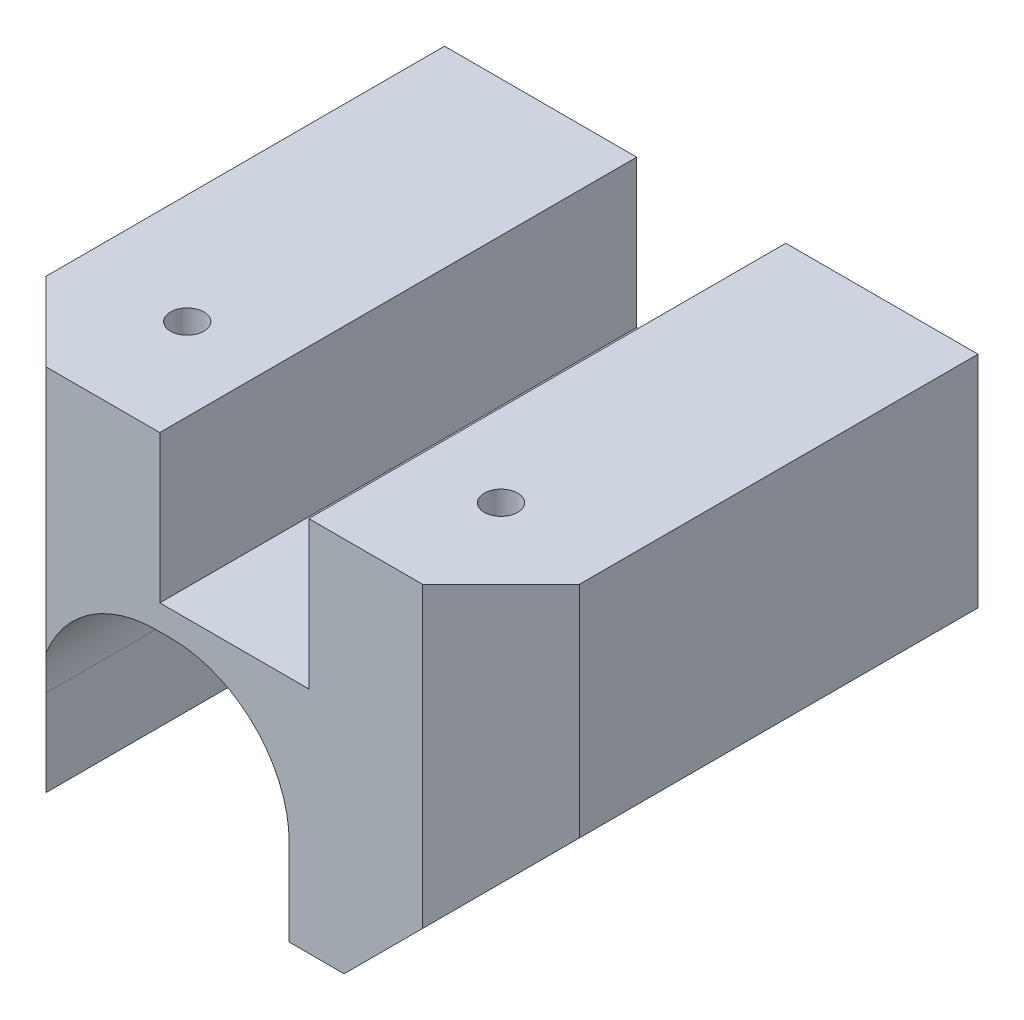
from build123d import *

# Parameters (mm, degrees)
SKETCH1_W                 = 43.18
SKETCH1_H                 = 38.608
BOSS_EXTRUDE1_DEPTH       = 30.48
SIDECHAMFER_SIZE          = 12.7
BACKCHAMFERS_SIZE         = 6.35
SKETCH2_W                 = 12.065
SKETCH2_H                 = 11.938
LINACTSLOT_DEPTH          = 54.719048428
MOUTINGHOLES_D            = 2.7051
MOUTINGHOLES_DEPTH        = 14.478
MOUTINGHOLES_TIP          = 0.81269403
CUT_EXTRUDE1_DEPTH        = 54.719048428
MOTORMOUNTINGHOLES2_D     = 2.2606
MOTORMOUNTINGHOLES2_DEPTH = 11.43
MOTORMOUNTINGHOLES2_TIP   = 0.679152758


with BuildPart() as part:
    # Sketch1 → Boss-Extrude1 (new body)
    with BuildSketch(Plane(origin=(0, 0, 0), x_dir=(1, 0, 0), z_dir=(0, 1, 0))):
        Rectangle(SKETCH1_W, SKETCH1_H)
    extrude(amount=BOSS_EXTRUDE1_DEPTH)

    # SideChamfer
    sidechamfer_edges = [part.edges().sort_by_distance(p)[0] for p in [
        (21.59, 0, 0),
    ]]
    chamfer(sidechamfer_edges, length=SIDECHAMFER_SIZE)

    # BackChamfers
    backchamfers_edges = [part.edges().sort_by_distance(p)[0] for p in [
        (-21.59, 15.24, 19.304),
        (21.59, 21.59, 19.304),
    ]]
    chamfer(backchamfers_edges, length=BACKCHAMFERS_SIZE)

    # Sketch2 → LinActSlot (cut, through all)
    with BuildSketch(Plane.XY.offset(19.304)):
        with Locations((0, 24.511)):
            Rectangle(SKETCH2_W, SKETCH2_H)
    extrude(amount=-LINACTSLOT_DEPTH, mode=Mode.SUBTRACT)

    # MoutingHoles
    with Locations(Plane(origin=(14.160350453, 30.48, 8.373414988), x_dir=(-1, 0, 0), z_dir=(0, 1, 0))):
        with Locations((1.460350453, 2.040585012), (26.860350453, 2.040585012)):
            Hole(MOUTINGHOLES_D / 2, depth=MOUTINGHOLES_DEPTH)
            with Locations((0, 0, -(MOUTINGHOLES_DEPTH + MOUTINGHOLES_TIP / 2))):  # 118° drill point
                Cone(0, MOUTINGHOLES_D / 2, MOUTINGHOLES_TIP, mode=Mode.SUBTRACT)

    # Sketch11 → Cut-Extrude1 (cut, through all)
    with BuildSketch(Plane(origin=(0, 0, -19.304), x_dir=(-1, 0, 0), z_dir=(0, 0, -1))):
        with BuildLine():
            Line((15.875, 6.35), (15.875, 6.985))
            ThreePointArc((15.875, 6.985), (13.085192091, 13.720192091), (6.35, 16.51))
            Line((6.35, 16.51), (5.08, 16.51))
            ThreePointArc((5.08, 16.51), (-1.655192091, 13.720192091), (-4.445, 6.985))
            Line((-4.445, 6.985), (-4.445, 6.35))
            Line((-4.445, 6.35), (-4.445, 0))
            Line((-4.445, 0), (15.875, 0))
            Line((15.875, 0), (15.875, 6.35))
        make_face()
    extrude(amount=-CUT_EXTRUDE1_DEPTH, mode=Mode.SUBTRACT)

    # MotorMountingHoles2
    with Locations(Plane(origin=(0, 0, -19.304), x_dir=(-1, 0, 0), z_dir=(0, 0, -1))):
        with Locations((18.2118, 6.985), (-6.7818, 6.985)):
            Hole(MOTORMOUNTINGHOLES2_D / 2, depth=MOTORMOUNTINGHOLES2_DEPTH)
            with Locations((0, 0, -(MOTORMOUNTINGHOLES2_DEPTH + MOTORMOUNTINGHOLES2_TIP / 2))):  # 118° drill point
                Cone(0, MOTORMOUNTINGHOLES2_D / 2, MOTORMOUNTINGHOLES2_TIP, mode=Mode.SUBTRACT)


solid = part.part
